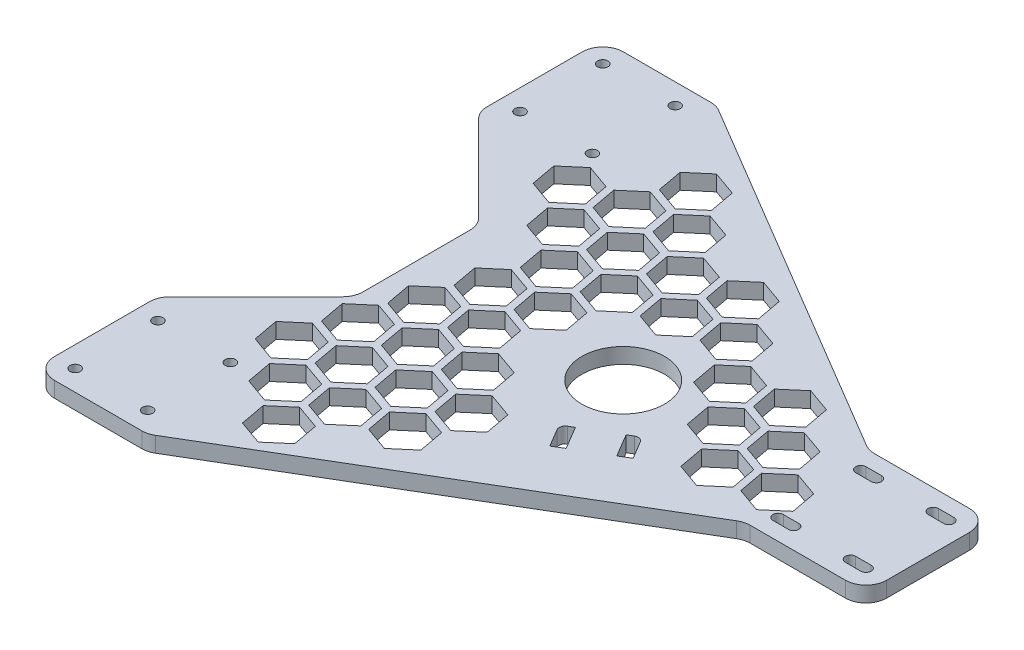
from build123d import *

# Parameters (mm, degrees)
ESQUISSE1_W             = 117.9
ESQUISSE1_H             = 110
BOSS_EXTRU_1_DEPTH      = 3
ESQUISSE2_R             = 1
ENL_V_MAT_EXTRU_1_DEPTH = 81.679009042
CONG_1_R                = 4
ESQUISSE3_R             = 8
ENL_V_MAT_EXTRU_2_DEPTH = 81.679009042
ENL_V_MAT_EXTRU_3_DEPTH = 81.679009042


with BuildPart() as part:
    # Esquisse1 → Boss.-Extru.1 (new body)
    with BuildSketch(Plane(origin=(0, 0, 0), x_dir=(1, 0, 0), z_dir=(0, 1, 0))):
        Rectangle(ESQUISSE1_W, ESQUISSE1_H)
    extrude(amount=BOSS_EXTRU_1_DEPTH)

    # Esquisse2 → Enlèv. mat.-Extru.1 (cut, through all)
    with BuildSketch(Plane(origin=(0, 0, 0), x_dir=(1, 0, 0), z_dir=(0, 1, 0))):
        with Locations((-40.95, -35)):
            Circle(ESQUISSE2_R)
        with Locations((-54.95, -35)):
            Circle(ESQUISSE2_R)
        with Locations((-54.95, -51)):
            Circle(ESQUISSE2_R)
        with Locations((-40.95, -51)):
            Circle(ESQUISSE2_R)
        with Locations((-40.95, 51)):
            Circle(ESQUISSE2_R)
        with Locations((-54.95, 51)):
            Circle(ESQUISSE2_R)
        with Locations((-54.95, 35)):
            Circle(ESQUISSE2_R)
        with Locations((-40.95, 35)):
            Circle(ESQUISSE2_R)
        Polygon((58.95, 12), (35.45, 12), (-36.95, 55), (58.95, 55), align=None)
        Polygon((58.95, -12), (35.45, -12), (-36.95, -55), (58.95, -55), align=None)
        Polygon((-58.95, -31), (-39.95, -12), (-39.95, 12), (-58.95, 31), align=None)
        with BuildLine():
            Line((37.95, 9), (40.95, 9))
            ThreePointArc((40.95, 9), (41.95, 8), (40.95, 7))
            Line((40.95, 7), (37.95, 7))
            ThreePointArc((37.95, 7), (36.95, 8), (37.95, 9))
        make_face()
        with BuildLine():
            Line((54.95, 7), (51.95, 7))
            ThreePointArc((51.95, 7), (50.95, 8), (51.95, 9))
            Line((51.95, 9), (54.95, 9))
            ThreePointArc((54.95, 9), (55.95, 8), (54.95, 7))
        make_face()
        with BuildLine():
            Line((37.95, -7), (40.95, -7))
            ThreePointArc((40.95, -7), (41.95, -8), (40.95, -9))
            Line((40.95, -9), (37.95, -9))
            ThreePointArc((37.95, -9), (36.95, -8), (37.95, -7))
        make_face()
        with BuildLine():
            Line((54.95, -9), (51.95, -9))
            ThreePointArc((51.95, -9), (50.95, -8), (51.95, -7))
            Line((51.95, -7), (54.95, -7))
            ThreePointArc((54.95, -7), (55.95, -8), (54.95, -9))
        make_face()
    extrude(amount=ENL_V_MAT_EXTRU_1_DEPTH, mode=Mode.SUBTRACT)

    # Congé1
    cong_1_edges = [part.edges().sort_by_distance(p)[0] for p in [
        (35.45, 1.5, 12),
        (58.95, 1.5, 12),
        (58.95, 1.5, -12),
        (35.45, 1.5, -12),
        (-36.95, 1.5, -55),
        (-58.95, 1.5, -55),
        (-58.95, 1.5, -31),
        (-39.95, 1.5, -12),
        (-39.95, 1.5, 12),
        (-58.95, 1.5, 31),
        (-58.95, 1.5, 55),
        (-36.95, 1.5, 55),
    ]]
    fillet(cong_1_edges, radius=CONG_1_R)

    # Esquisse3 → Enlèv. mat.-Extru.2 (cut, through all)
    with BuildSketch(Plane(origin=(0, 0, 0), x_dir=(1, 0, 0), z_dir=(0, 1, 0))):
        Circle(ESQUISSE3_R)
    extrude(amount=ENL_V_MAT_EXTRU_2_DEPTH, mode=Mode.SUBTRACT)

    # Esquisse4 → Enlèv. mat.-Extru.3 (cut, through all)
    with BuildSketch(Plane.XZ):
        with BuildLine():
            Line((3.923383697, 18.110861668), (1.880789687, 14.671703383))
            ThreePointArc((1.880789687, 14.671703383), (1.755144731, 13.800545585), (2.282301917, 13.095699598))
            Line((2.282301917, 13.095699598), (3.271059924, 12.50845382))
            Line((3.271059924, 12.50845382), (5.900899711, 16.936370113))
            Line((5.900899711, 16.936370113), (3.923383697, 18.110861668))
        make_face()
        with BuildLine():
            Line((9.418555359, 8.857317029), (12.048395146, 13.285233321))
            Line((12.048395146, 13.285233321), (14.025911161, 12.110741766))
            Line((14.025911161, 12.110741766), (11.983317151, 8.67158348))
            ThreePointArc((11.983317151, 8.67158348), (11.278471164, 8.144426295), (10.407313366, 8.270071251))
            Line((10.407313366, 8.270071251), (9.418555359, 8.857317029))
        make_face()
        Polygon((-20.80604881, -41.888381175), (-19.895996519, -36.971898202), (-23.698769526, -33.725528312), (-28.411594823, -35.395641396), (-29.321647114, -40.31212437), (-25.518874107, -43.558494259), align=None)
        Polygon((-24.226250243, -32.491454967), (-23.316197952, -27.574971994), (-27.118970959, -24.328602104), (-31.831796257, -25.998715188), (-32.741848548, -30.915198162), (-28.939075541, -34.161568051), align=None)
        Polygon((-27.646451676, -23.094528759), (-26.736399385, -18.178045786), (-30.539172392, -14.931675896), (-35.25199769, -16.60178898), (-36.162049981, -21.518271954), (-32.359276974, -24.764641843), align=None)
        Polygon((-14.378172713, -34.227936744), (-13.468120422, -29.31145377), (-17.270893429, -26.065083881), (-21.983718727, -27.735196965), (-22.893771017, -32.651679938), (-19.090998011, -35.898049828), align=None)
        Polygon((-17.804119321, -24.815225798), (-16.89406703, -19.898742825), (-20.696840037, -16.652372935), (-25.409665334, -18.322486019), (-26.319717625, -23.238968993), (-22.516944619, -26.485338882), align=None)
        Polygon((-34.074327773, -30.75497319), (-33.164275482, -25.838490217), (-36.967048489, -22.592120328), (-41.679873787, -24.262233412), (-42.589926078, -29.178716385), (-38.787153071, -32.425086274), align=None)
        Polygon((-11.376243224, -17.154781367), (-10.466190933, -12.238298394), (-14.26896394, -8.991928504), (-18.981789238, -10.662041588), (-19.891841528, -15.578524562), (-16.089068522, -18.824894451), align=None)
        Polygon((-21.224320754, -15.41829959), (-20.314268463, -10.501816617), (-24.11704147, -7.255446728), (-28.829866768, -8.925559812), (-29.739919059, -13.842042785), (-25.937146052, -17.088412674), align=None)
        Polygon((-24.638777013, -6.03715812), (-23.728724722, -1.120675147), (-27.531497729, 2.125694743), (-32.244323026, 0.455581659), (-33.154375317, -4.460901315), (-29.35160231, -7.707271204), align=None)
        Polygon((-14.790699483, -7.773639897), (-13.880647192, -2.857156923), (-17.683420198, 0.389212966), (-22.396245496, -1.280900118), (-23.306297787, -6.197383091), (-19.50352478, -9.443752981), align=None)
        Polygon((-18.210900916, 1.623286311), (-17.300848625, 6.539769284), (-21.103621632, 9.786139174), (-25.816446929, 8.11602609), (-26.72649922, 3.199543116), (-22.923726214, -0.046826773), align=None)
        Polygon((-21.631102349, 11.020212519), (-20.721050058, 15.936695492), (-24.523823065, 19.183065382), (-29.236648363, 17.512952298), (-30.146700654, 12.596469324), (-26.343927647, 9.350099435), align=None)
        Polygon((-25.051303782, 20.417138727), (-24.141251491, 25.3336217), (-27.944024498, 28.57999159), (-32.656849796, 26.909878506), (-33.566902087, 21.993395532), (-29.76412908, 18.747025643), align=None)
        Polygon((-28.471505216, 29.814064935), (-27.561452925, 34.730547908), (-31.364225932, 37.976917797), (-36.077051229, 36.306804713), (-36.98710352, 31.39032174), (-33.184330513, 28.143951851), align=None)
        Polygon((-28.058978446, 3.359768088), (-27.148926155, 8.276251061), (-30.951699162, 11.522620951), (-35.66452446, 9.852507866), (-36.57457675, 4.936024893), (-32.771803744, 1.689655004), align=None)
        Polygon((-15.203226252, 18.68065695), (-14.293173961, 23.597139923), (-18.095946968, 26.843509813), (-22.808772266, 25.173396729), (-23.718824557, 20.256913755), (-19.91605155, 17.010543866), align=None)
        Polygon((-8.775350155, 26.341101381), (-7.865297864, 31.257584355), (-11.668070871, 34.503954244), (-16.380896169, 32.83384116), (-17.29094846, 27.917358187), (-13.488175453, 24.670988297), align=None)
        Polygon((-18.623427685, 28.077583158), (-17.713375395, 32.994066131), (-21.516148401, 36.240436021), (-26.228973699, 34.570322937), (-27.13902599, 29.653839963), (-23.336252983, 26.407470074), align=None)
        Polygon((-22.043629119, 37.474509366), (-21.133576828, 42.390992339), (-24.936349835, 45.637362229), (-29.649175132, 43.967249145), (-30.559227423, 39.050766171), (-26.756454416, 35.804396282), align=None)
        Polygon((-34.899381312, 22.153620503), (-33.989329022, 27.070103477), (-37.792102028, 30.316473366), (-42.504927326, 28.646360282), (-43.414979617, 23.729877309), (-39.61220661, 20.483507419), align=None)
        Polygon((-31.479179879, 12.756694296), (-30.569127588, 17.673177269), (-34.371900595, 20.919547158), (-39.084725893, 19.249434074), (-39.994778184, 14.332951101), (-36.192005177, 11.086581212), align=None)
        Polygon((-11.783024819, 9.283730742), (-10.872972528, 14.200213716), (-14.675745535, 17.446583605), (-19.388570833, 15.776470521), (-20.298623123, 10.859987548), (-16.495850117, 7.613617658), align=None)
        Polygon((-7.956041791, -26.551707575), (-7.0459895, -21.635224601), (-10.848762507, -18.388854712), (-15.561587804, -20.058967796), (-16.471640095, -24.97545077), (-12.668867088, -28.221820659), align=None)
        Polygon((-1.528165694, -18.891263144), (-0.618113403, -13.97478017), (-4.42088641, -10.728410281), (-9.133711707, -12.398523365), (-10.043763998, -17.315006338), (-6.240990992, -20.561376228), align=None)
        Polygon((8.319911836, -20.62774492), (9.229964127, -15.711261947), (5.42719112, -12.464892058), (0.714365823, -14.135005142), (-0.195686468, -19.051488115), (3.607086539, -22.297858004), align=None)
        Polygon((14.747787933, -12.967300489), (15.657840224, -8.050817516), (11.855067217, -4.804447626), (7.14224192, -6.47456071), (6.232189629, -11.391043684), (10.034962635, -14.637413573), align=None)
        Polygon((21.17566403, -5.306856058), (22.085716321, -0.390373085), (18.282943314, 2.855996805), (13.570118016, 1.185883721), (12.660065725, -3.730599253), (16.462838732, -6.976969142), align=None)
        Polygon((27.603540127, 2.353588373), (28.513592418, 7.270071347), (24.710819411, 10.516441236), (19.997994113, 8.846328152), (19.087941822, 3.929845179), (22.890714829, 0.683475289), align=None)
        Polygon((24.595865463, -14.703782266), (25.505917754, -9.787299292), (21.703144747, -6.540929403), (16.99031945, -8.211042487), (16.080267159, -13.12752546), (19.883040166, -16.37389535), align=None)
        Polygon((31.02374156, -7.043337835), (31.933793851, -2.126854861), (28.131020844, 1.119515028), (23.418195547, -0.550598056), (22.508143256, -5.467081029), (26.310916262, -8.713450919), align=None)
        Polygon((37.451617657, 0.617106597), (38.361669948, 5.53358957), (34.558896941, 8.779959459), (29.846071643, 7.109846375), (28.936019352, 2.193363402), (32.738792359, -1.053006487), align=None)
        Polygon((-5.355148722, 16.944175173), (-4.445096431, 21.860658147), (-8.247869438, 25.107028036), (-12.960694736, 23.436914952), (-13.870747027, 18.520431979), (-10.06797402, 15.274062089), align=None)
        Polygon((1.892035739, -28.288189352), (2.80208803, -23.371706378), (-1.000684977, -20.125336489), (-5.713510274, -21.795449573), (-6.623562565, -26.711932546), (-2.820789558, -29.958302436), align=None)
    extrude(amount=-ENL_V_MAT_EXTRU_3_DEPTH, mode=Mode.SUBTRACT)


solid = part.part
